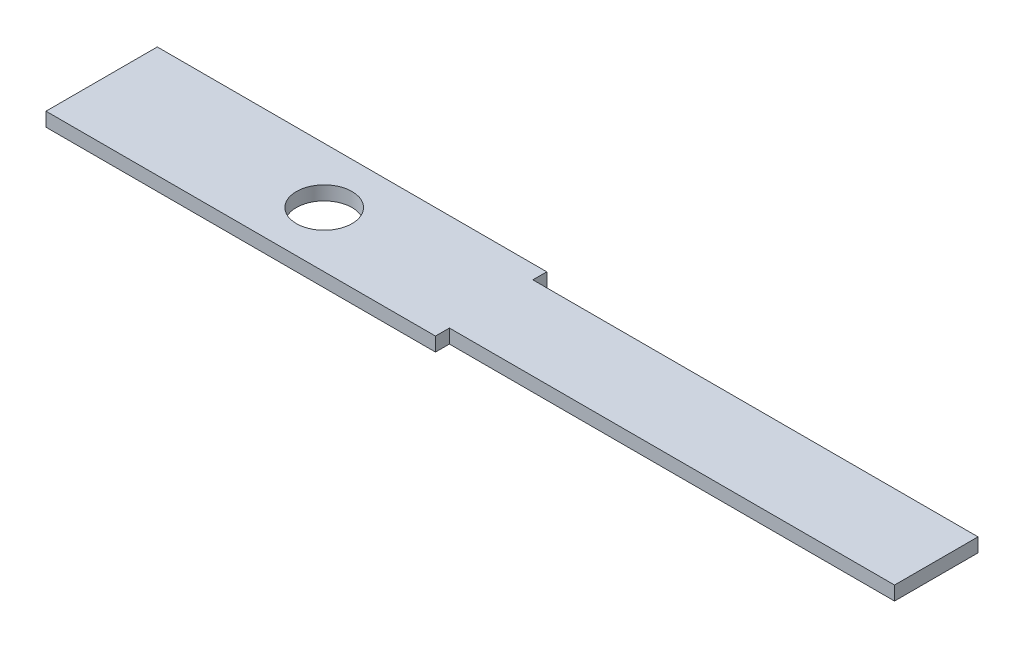
from build123d import *

# Parameters (mm, degrees)
SKETCH1_R           = 3.175
BOSS_EXTRUDE1_DEPTH = 1.5875


with BuildPart() as part:
    # Sketch1 → Boss-Extrude1 (new body)
    with BuildSketch(Plane(origin=(0, 0, 0), x_dir=(1, 0, 0), z_dir=(0, 1, 0))):
        Polygon((-31.75, 0), (12.7, 0), (12.7, 1.5875), (63.5, 1.5875), (63.5, 11.1125), (12.7, 11.1125), (12.7, 12.7), (-31.75, 12.7), align=None)
        with Locations((-6.35, 6.35)):
            Circle(SKETCH1_R, mode=Mode.SUBTRACT)
    extrude(amount=BOSS_EXTRUDE1_DEPTH)


solid = part.part
